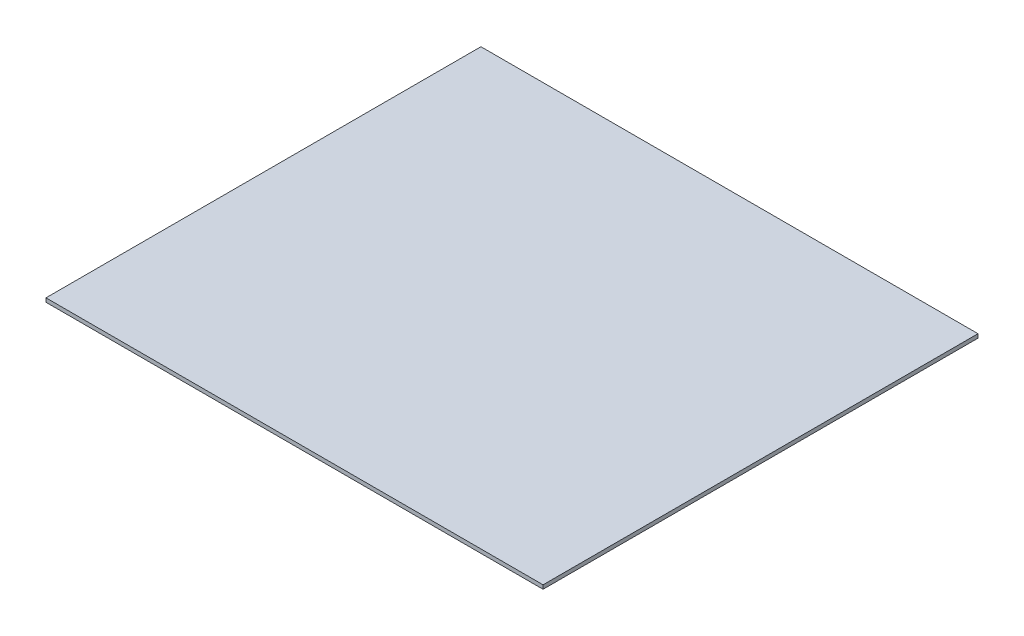
from build123d import *

# Parameters (mm, degrees)
SKETCH1_W          = 203.2
SKETCH1_H          = 177.8
BASE_FLANGE1_DEPTH = 1.5875


# Sheet-metal steps are written as plain solids
with BuildPart() as part:
    # Sketch1 → Base-Flange1 (new body)
    with BuildSketch(Plane(origin=(0, 0, 0), x_dir=(1, 0, 0), z_dir=(0, 1, 0))):
        Rectangle(SKETCH1_W, SKETCH1_H)
    extrude(amount=-BASE_FLANGE1_DEPTH)


solid = part.part
